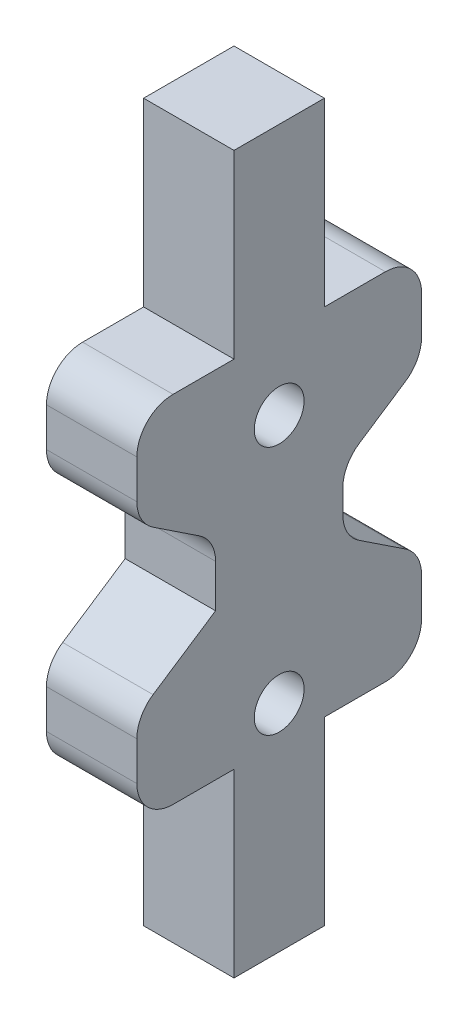
from build123d import *

# Parameters (mm, degrees)
SKETCH1_R           = 1.75
BOSS_EXTRUDE1_DEPTH = 6.35
FILLET1_R           = 2.54


with BuildPart() as part:
    # Sketch1 → Boss-Extrude1 (new body)
    with BuildSketch(Plane(origin=(0, 0, 0), x_dir=(0, 0, -1), z_dir=(1, 0, 0))):
        Polygon((0, 0), (6.825, 0), (6.825, -12.7), (13.175, -12.7), (13.175, 0), (20, 0), (20, 6.629574014), (14.471500996, 10.288392178), (14.471500996, 14.663602622), (20, 18.322420786), (20, 24.9519948), (13.175, 24.9519948), (13.175, 37.6519948), (6.825, 37.6519948), (6.825, 24.9519948), (0, 24.9519948), (0, 18.322420786), (5.528499004, 14.663602622), (5.528499004, 10.288392178), (0, 6.629574014), align=None)
        with Locations((10, 19.9519948)):
            Circle(SKETCH1_R, mode=Mode.SUBTRACT)
        with Locations((10, 2.4259948)):
            Circle(SKETCH1_R, mode=Mode.SUBTRACT)
    extrude(amount=BOSS_EXTRUDE1_DEPTH)

    # Fillet1
    fillet1_edges = [part.edges().sort_by_distance(p)[0] for p in [
        (3.175, 14.663602622, -14.471500996),
        (3.175, 18.322420786, -20),
        (3.175, 10.288392178, -14.471500996),
        (3.175, 6.629574014, -20),
        (3.175, 0, -20),
        (3.175, 0, 0),
        (3.175, 6.629574014, 0),
        (3.175, 14.663602622, -5.528499004),
        (3.175, 18.322420786, 0),
        (3.175, 24.9519948, 0),
        (3.175, 24.9519948, -20),
    ]]
    fillet(fillet1_edges, radius=FILLET1_R)


solid = part.part
